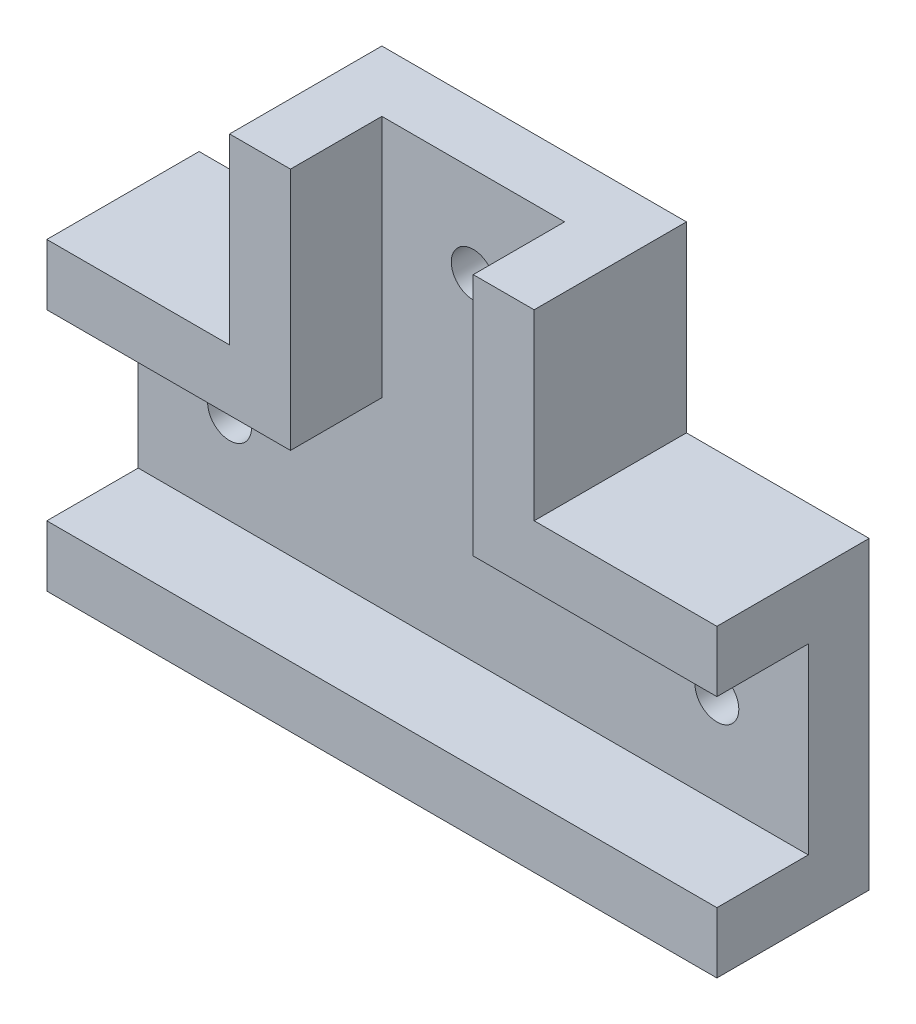
from build123d import *

# Parameters (mm, degrees)
BOSS_EXTRUDE1_DEPTH = 5
BOSS_EXTRUDE2_DEPTH = 12.5
SKETCH4_W           = 55
SKETCH4_H           = 5
BOSS_EXTRUDE3_DEPTH = 12.5
SKETCH6_R           = 1.8
CUT_EXTRUDE3_DEPTH  = 43.690253086


with BuildPart() as part:
    # Sketch1 → Boss-Extrude1 (new body)
    with BuildSketch(Plane.XY):
        Polygon((14.31372549, -4.264705882), (34.31372549, -4.264705882), (34.31372549, -19.264705882), (-20.68627451, -19.264705882), (-20.68627451, -4.264705882), (-0.68627451, -4.264705882), (-0.68627451, 15.735294118), (14.31372549, 15.735294118), align=None)
    extrude(amount=BOSS_EXTRUDE1_DEPTH)

    # Sketch2 → Boss-Extrude2 (add)
    with BuildSketch(Plane(origin=(0, 0, 0), x_dir=(-1, 0, 0), z_dir=(0, 0, -1))):
        Polygon((0.68627451, 15.735294118), (5.68627451, 15.735294118), (5.68627451, 0.735294118), (6.079970528, 0.735294118), (20.68627451, 0.735294118), (20.68627451, -4.264705882), (0.68627451, -4.264705882), align=None)
    boss_extrude2 = extrude(amount=-BOSS_EXTRUDE2_DEPTH)

    # Sketch4 → Boss-Extrude3 (add)
    with BuildSketch(Plane(origin=(0, 0, 0), x_dir=(-1, 0, 0), z_dir=(0, 0, -1))):
        with Locations((-6.81372549, -21.764705882)):
            Rectangle(SKETCH4_W, SKETCH4_H)
    extrude(amount=-BOSS_EXTRUDE3_DEPTH)

    # Mirror1: Boss-Extrude2 across plane
    add(boss_extrude2.mirror(Plane.ZY.offset(-6.81372549)))

    # Sketch6 → Cut-Extrude3 (cut, through all)
    with BuildSketch(Plane.XY.offset(5)):
        with Locations((6.81372549, 8.235294118)):
            Circle(SKETCH6_R)
        with Locations((-13.18627451, -11.764705882)):
            Circle(SKETCH6_R)
        with Locations((26.81372549, -11.764705882)):
            Circle(SKETCH6_R)
    extrude(amount=-CUT_EXTRUDE3_DEPTH, mode=Mode.SUBTRACT)


solid = part.part
